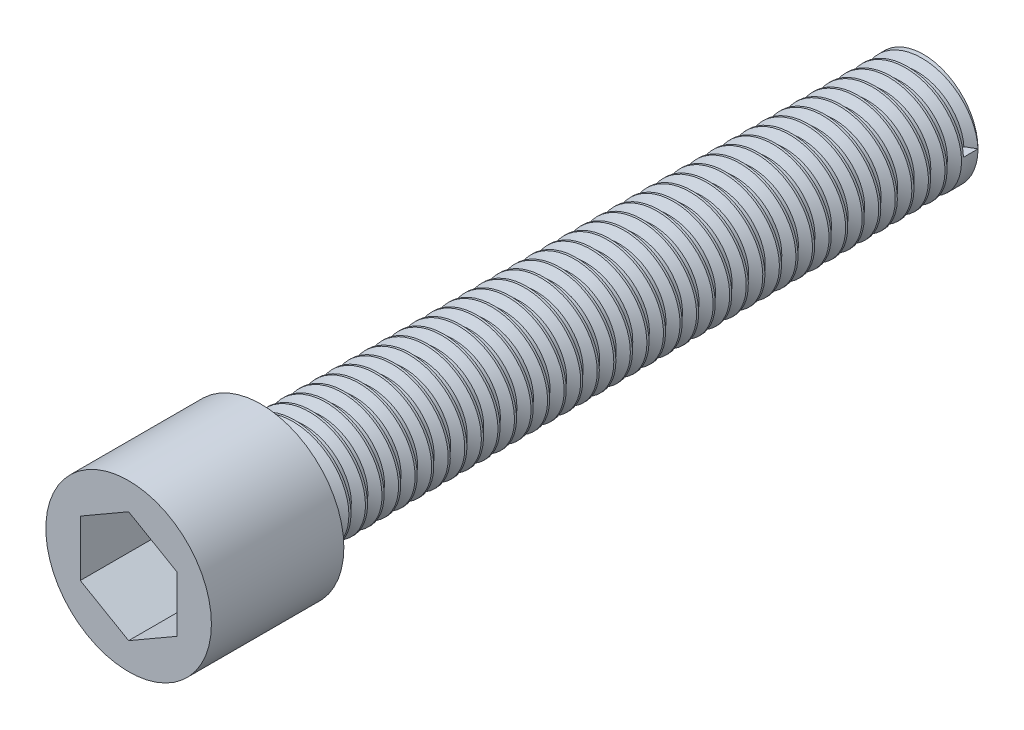
from build123d import *

# Parameters (mm, degrees)
ESBO_O1_R                = 3.3
RESSALTO_EXTRUS_O1_DEPTH = 40
ESBO_O2_R                = 5
RESSALTO_EXTRUS_O2_DEPTH = 8
CORTE_EXTRUS_O1_DEPTH    = 5
ROSCA1_PITCH             = 1


with BuildPart() as part:
    # Esboço1 → Ressalto-extrusão1 (new body)
    with BuildSketch(Plane.XY):
        Circle(ESBO_O1_R)
    extrude(amount=RESSALTO_EXTRUS_O1_DEPTH)

    # Esboço2 → Ressalto-extrusão2 (add)
    with BuildSketch(Plane.XY.offset(40)):
        Circle(ESBO_O2_R)
    extrude(amount=RESSALTO_EXTRUS_O2_DEPTH)

    # Esboço3 → Corte-extrusão1 (cut)
    with BuildSketch(Plane.XY.offset(48)):
        Polygon((0, 3.370378916), (-2.918833762, 1.685189458), (-2.918833762, -1.685189458), (0, -3.370378916), (2.918833762, -1.685189458), (2.918833762, 1.685189458), align=None)
    extrude(amount=-CORTE_EXTRUS_O1_DEPTH, mode=Mode.SUBTRACT)

    # Rosca1: the profile of Perfil da rosca2 profile screwed along a right-hand helix of 40 turns, 8 arcs to a turn; built about Z, then put on its axis
    rosca1_z = Axis((0, 0, 0), (0, 0, 1))
    rosca1_corners = [(3.3003, 0, -0.000173205), (3.3003, 0, 0.875173202), (2.758734125, 0, 0.562499999), (2.758734125, 0, 0.312499999)]
    with BuildLine(mode=Mode.PRIVATE) as rosca1_profile:
        Line(rosca1_corners[0], rosca1_corners[1])
        Line(rosca1_corners[1], rosca1_corners[2])
        Line(rosca1_corners[2], rosca1_corners[3])
        Line(rosca1_corners[3], rosca1_corners[0])
    rosca1_cap = Face(rosca1_profile.wire())
    rosca1_turn_angles = [0, 22.5, 45, 67.5, 90, 112.5, 135, 157.5, 180, 202.5, 225, 247.5, 270, 292.5, 315, 337.5, 360, 382.5, 405, 427.5, 450, 472.5, 495, 517.5, 540, 562.5, 585, 607.5, 630, 652.5, 675, 697.5, 720]
    rosca1_turn_weights = [1, 0.9238795325112867, 1, 0.9238795325112867, 1, 0.9238795325112867, 1, 0.9238795325112867, 1, 0.9238795325112867, 1, 0.9238795325112867, 1, 0.9238795325112867, 1, 0.9238795325112867, 1, 0.9238795325112867, 1, 0.9238795325112867, 1, 0.9238795325112867, 1, 0.9238795325112867, 1, 0.9238795325112867, 1, 0.9238795325112867, 1, 0.9238795325112867, 1, 0.9238795325112867, 1]
    rosca1_turn_rails = [Edge.make_bspline([Vector(p[0], p[1], 0).rotate(rosca1_z, rosca1_turn_angles[k]) / rosca1_turn_weights[k] + Vector(0, 0, p[2] + ROSCA1_PITCH * rosca1_turn_angles[k] / 360) for k in range(33)], [0, 0, 0, 1, 1, 2, 2, 3, 3, 4, 4, 5, 5, 6, 6, 7, 7, 8, 8, 9, 9, 10, 10, 11, 11, 12, 12, 13, 13, 14, 14, 15, 15, 16, 16, 16], 2, rosca1_turn_weights) for p in rosca1_corners]
    rosca1_turn_sides = [Face.make_surface_from_curves(rosca1_turn_rails[p[0]], rosca1_turn_rails[p[1]]) for p in [(0, 1), (1, 2), (2, 3), (3, 0)]]
    rosca1 = Plane(origin=(0, 0, 0), x_dir=(1, 0, 0), z_dir=(0, 0, 1)) * Solid(Shell([*[p.moved(Location((0, 0, 2 * ROSCA1_PITCH * i))) for i in range(20) for p in rosca1_turn_sides], rosca1_cap, rosca1_cap.rotate(rosca1_z, 14400).moved(Location((0, 0, ROSCA1_PITCH * 14400 / 360)))]))
    add(rosca1, mode=Mode.SUBTRACT)


solid = part.part
